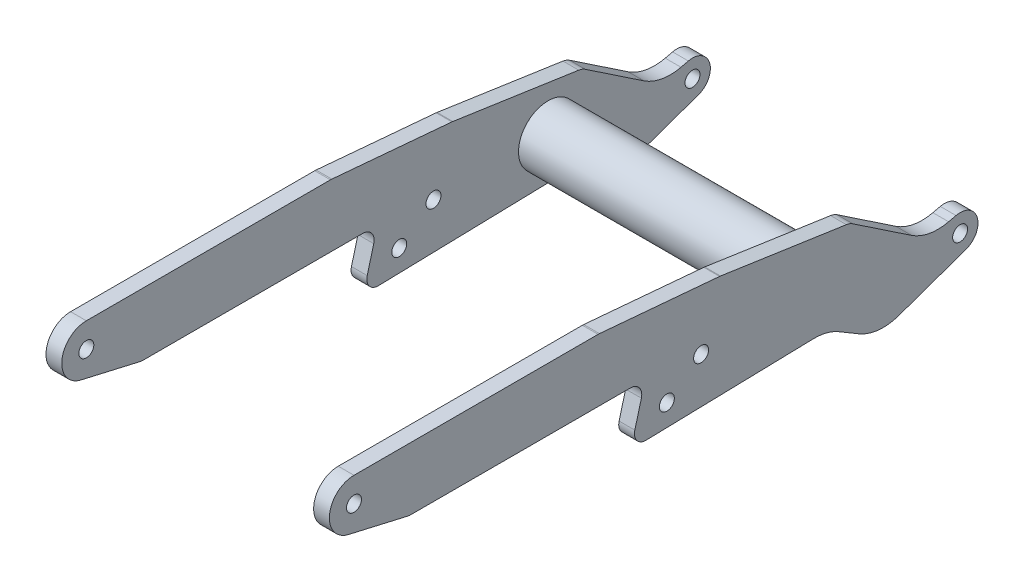
from build123d import *

# Parameters (mm, degrees)
SKETCH1_R                = 0.95
BOSS_EXTRUDE1_DEPTH      = 18
FILLET1_R                = 2
CUT_EXTRUDE1_DEPTH       = 83.531401045
CUT_EXTRUDE1_DEPTH_BACK  = 83.531401045
SKETCH2_W                = 32
SKETCH2_H                = 101.957647254
BOSS_EXTRUDE2_DEPTH      = 16
BOSS_EXTRUDE2_DEPTH_BACK = 18
SKETCH3_R                = 3.75


with BuildPart() as part:
    # Sketch1 → Boss-Extrude1 (new, symmetric)
    with BuildSketch(Plane(origin=(0, 0, 0), x_dir=(0, 0, -1), z_dir=(1, 0, 0))):
        with BuildLine():
            Line((0, 3.125), (31.1, 3.125))
            Line((31.1, 3.125), (46.5, 1.777674582))
            Line((46.5, 1.777674582), (63, -0.644122384))
            Line((63, -0.644122384), (70.830964262, -5.89639821))
            ThreePointArc((70.830964262, -5.89639821), (73.097482893, -6.816208289), (75.542765767, -6.754979641))
            Line((75.542765767, -6.754979641), (76.480663736, -6.535070013))
            ThreePointArc((76.480663736, -6.535070013), (79.183357394, -8.1108009), (77.757164464, -10.895303469))
            Line((77.757164464, -10.895303469), (69.23684377, -13.902469654))
            ThreePointArc((69.23684377, -13.902469654), (66.658598046, -14.216298138), (64.18928422, -13.41110961))
            Line((64.18928422, -13.41110961), (61.581493884, -11.871323024))
            ThreePointArc((61.581493884, -11.871323024), (60.039213852, -11.230596721), (58.380071029, -11.039801059))
            Line((58.380071029, -11.039801059), (37.117058695, -11.574311392))
            ThreePointArc((37.117058695, -11.574311392), (35.941440636, -11.021859195), (35.680027609, -9.749481703))
            Line((35.680027609, -9.749481703), (36.510915657, -6.64856529))
            ThreePointArc((36.510915657, -6.64856529), (36.260685553, -5.390573603), (35.110323209, -4.823277675))
            Line((35.110323209, -4.823277675), (7, -4.823277675))
            Line((7, -4.823277675), (-0.702972045, -3.044906452))
            ThreePointArc((-0.702972045, -3.044906452), (-3.104912049, 0.353760043), (0, 3.125))
        make_face()
        Circle(SKETCH1_R, mode=Mode.SUBTRACT)
        with Locations((77, -8.75)):
            Circle(SKETCH1_R, mode=Mode.SUBTRACT)
        with Locations((39.75, -8.75)):
            Circle(SKETCH1_R, mode=Mode.SUBTRACT)
        with Locations((44.1, -5.6)):
            Circle(SKETCH1_R, mode=Mode.SUBTRACT)
    extrude(amount=BOSS_EXTRUDE1_DEPTH, both=True)

    # Fillet1
    # the kernel refuses this fillet: 2 mm, written as the material it takes off along each edge
    with BuildSketch(Plane(origin=(18.569678042, -4.823277675, -7), x_dir=(0, 0, -1), z_dir=(-1, 0, 0))) as fillet1_piece_1:
        with BuildLine():
            CenterArc((FILLET1_R * 0.113935608302, -FILLET1_R), FILLET1_R, 90, 13)
            Line((-FILLET1_R * 0.111015446042, -FILLET1_R * 0.0256299352148), (0, 0))
            Line((0, 0), (FILLET1_R * 0.113935608302, 0))
        make_face()
    extrude(amount=37.139356083, mode=Mode.SUBTRACT)
    with BuildSketch(Plane(origin=(18.218304715, 3.125, -31.1), x_dir=(0, -0.08715574274766148, -0.9961946980917452), z_dir=(-1, 0, 0))) as fillet1_piece_2:
        with BuildLine():
            CenterArc((FILLET1_R * 0.0436609429085, FILLET1_R), FILLET1_R, 265, 5)
            Line((-FILLET1_R * 0.0434947998391, FILLET1_R * 0.00380530190825), (0, 0))
            Line((0, 0), (FILLET1_R * 0.0436609429085, 0))
        make_face()
    extrude(amount=36.436609429, mode=Mode.SUBTRACT)
    with BuildSketch(Plane(origin=(18.14621298, 1.777674582, -46.5), x_dir=(0, -0.1452196700772367, -0.9893994377513354), z_dir=(-1, 0, 0))) as fillet1_piece_3:
        with BuildLine():
            CenterArc((FILLET1_R * 0.0292425960983, FILLET1_R), FILLET1_R, 266.65, 3.35)
            Line((-FILLET1_R * 0.02919262642, FILLET1_R * 0.00170879761001), (0, 0))
            Line((0, 0), (FILLET1_R * 0.0292425960983, 0))
        make_face()
    extrude(amount=36.292425961, mode=Mode.SUBTRACT)
    with BuildSketch(Plane(origin=(19.131384491, -0.644122384, -63), x_dir=(0, -0.5570205743376945, -0.8304986934152907), z_dir=(-1, 0, 0))) as fillet1_piece_4:
        with BuildLine():
            CenterArc((FILLET1_R * 0.226276898255, FILLET1_R), FILLET1_R, 244.5, 25.5)
            Line((-FILLET1_R * 0.204234198553, FILLET1_R * 0.0974147156501), (0, 0))
            Line((0, 0), (FILLET1_R * 0.226276898255, 0))
        make_face()
    extrude(amount=38.262768983, mode=Mode.SUBTRACT)

    # Sketch2 → Cut-Extrude1 (cut, two sides: drawn at the far end of the back side and taken through both)
    with BuildSketch(Plane(origin=(0, 0, 0), x_dir=(1, 0, 0), z_dir=(0, 1, 0)).offset(-CUT_EXTRUDE1_DEPTH_BACK)):
        with Locations((0, 38.94963668)):
            Rectangle(SKETCH2_W, SKETCH2_H)
    extrude(amount=CUT_EXTRUDE1_DEPTH + CUT_EXTRUDE1_DEPTH_BACK, mode=Mode.SUBTRACT)


with BuildPart() as cut_extrude1_piece_1:
    # of the separate pieces the step leaves, piece 1, a body of its own (cut_extrude1_pieces)
    add(part.part.solids().sort_by_distance((-18, -4.823277675, -35.110323209))[0])



with BuildPart() as cut_extrude1_piece_2:
    # of the separate pieces the step leaves, piece 2, a body of its own (cut_extrude1_pieces)
    add(part.part.solids().sort_by_distance((16, -4.823277675, -35.110323209))[0])


with BuildPart() as cut_extrude1_piece_1_1:
    add(cut_extrude1_piece_1.part)

    add(cut_extrude1_piece_2.part)  # Boss-Extrude2 merges Cut-Extrude1 piece 2
    # Sketch3 → Boss-Extrude2 (add, two sides: drawn at the far end of the back side and taken through both)
    with BuildSketch(Plane(origin=(0, 0, 0), x_dir=(0, 0, -1), z_dir=(1, 0, 0)).offset(-BOSS_EXTRUDE2_DEPTH_BACK)):
        with Locations((58.65, -5.75)):
            Circle(SKETCH3_R)
    extrude(amount=BOSS_EXTRUDE2_DEPTH + BOSS_EXTRUDE2_DEPTH_BACK)


solid = cut_extrude1_piece_1_1.part
